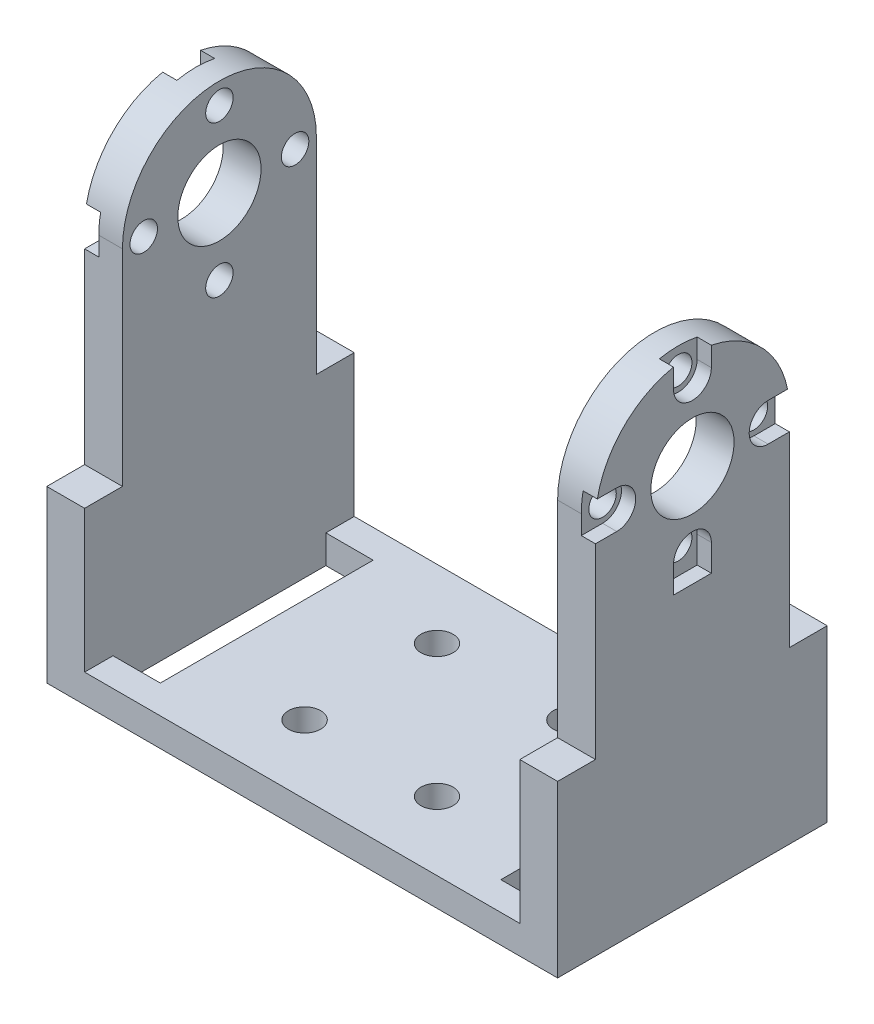
from build123d import *

# Parameters (mm, degrees)
SKETCH1_W           = 54
SKETCH1_H           = 28.5
SKETCH1_W_2         = 5
SKETCH1_H_2         = 22.5
SKETCH1_R           = 1.7
SKETCH1_R_2         = 7.5
BOSS_EXTRUDE2_DEPTH = 3
SKETCH2_W           = 4
SKETCH2_H           = 20.5
BOSS_EXTRUDE3_DEPTH = 21.75
SKETCH4_R           = 10.25
BOSS_EXTRUDE4_DEPTH = 4
SKETCH6_R           = 4.4
SKETCH6_R_2         = 1.45
CUT_EXTRUDE3_DEPTH  = 4
SKETCH7_R           = 1.45
CUT_EXTRUDE4_DEPTH  = 1.5
SKETCH8_W           = 28.781481152
SKETCH8_H           = 28.5
BOSS_EXTRUDE5_DEPTH = 3
SKETCH9_R           = 1.7
CUT_EXTRUDE5_DEPTH  = 3
SKETCH10_W          = 54
SKETCH10_H          = 28.5
SKETCH10_R          = 1.7
SKETCH10_W_2        = 5
SKETCH10_H_2        = 22.5
BOSS_EXTRUDE6_DEPTH = 15
SKETCH11_W          = 46
SKETCH11_H          = 15
CUT_EXTRUDE6_DEPTH  = 53.595151868


with BuildPart() as part:
    # Sketch1 → Boss-Extrude2 (new body)
    with BuildSketch(Plane(origin=(0, 0, 0), x_dir=(1, 0, 0), z_dir=(0, 1, 0))):
        Rectangle(SKETCH1_W, SKETCH1_H)
        with Locations((20.5, 0)):
            Rectangle(SKETCH1_W_2, SKETCH1_H_2, mode=Mode.SUBTRACT)
        with Locations((-20.5, 0)):
            Rectangle(SKETCH1_W_2, SKETCH1_H_2, mode=Mode.SUBTRACT)
        with Locations((-9, -8.25)):
            Circle(SKETCH1_R, mode=Mode.SUBTRACT)
        with Locations((9, -8.25)):
            Circle(SKETCH1_R, mode=Mode.SUBTRACT)
        with Locations((-9, 8.25)):
            Circle(SKETCH1_R, mode=Mode.SUBTRACT)
        Circle(SKETCH1_R_2, mode=Mode.SUBTRACT)
        with Locations((9, 8.25)):
            Circle(SKETCH1_R, mode=Mode.SUBTRACT)
    extrude(amount=BOSS_EXTRUDE2_DEPTH)

    # Sketch2 → Boss-Extrude3 (add)
    with BuildSketch(Plane(origin=(0, 3, 0), x_dir=(1, 0, 0), z_dir=(0, 1, 0))):
        with Locations((25, 0)):
            Rectangle(SKETCH2_W, SKETCH2_H)
    boss_extrude3 = extrude(amount=BOSS_EXTRUDE3_DEPTH)

    # Sketch4 → Boss-Extrude4 (add)
    with BuildSketch(Plane(origin=(27, 0, 0), x_dir=(0, 0, -1), z_dir=(1, 0, 0))):
        with Locations((0, 24.75)):
            Circle(SKETCH4_R)
    boss_extrude4 = extrude(amount=-BOSS_EXTRUDE4_DEPTH)

    # Mirror1: Boss-Extrude3, Boss-Extrude4 across plane
    add(boss_extrude3.mirror(Plane(origin=(0, 0, 0), x_dir=(0, 0, 1), z_dir=(1, 0, 0))))
    add(boss_extrude4.mirror(Plane(origin=(0, 0, 0), x_dir=(0, 0, 1), z_dir=(1, 0, 0))))

    # Sketch6 → Cut-Extrude3 (cut)
    with BuildSketch(Plane(origin=(27, 0, 0), x_dir=(0, 0, -1), z_dir=(1, 0, 0))):
        with Locations((0, 24.75)):
            Circle(SKETCH6_R)
        with Locations((8, 24.75)):
            Circle(SKETCH6_R_2)
        with Locations((0, 32.75)):
            Circle(SKETCH6_R_2)
        with Locations((0, 16.75)):
            Circle(SKETCH6_R_2)
        with Locations((-8, 24.75)):
            Circle(SKETCH6_R_2)
    cut_extrude3 = extrude(amount=-CUT_EXTRUDE3_DEPTH, mode=Mode.SUBTRACT)

    # Mirror3: Cut-Extrude3 across plane
    add(cut_extrude3.mirror(Plane(origin=(0, 0, 0), x_dir=(0, 0, 1), z_dir=(1, 0, 0))), mode=Mode.SUBTRACT)

    # Sketch7 → Cut-Extrude4 (cut)
    # profile 1 of 4: a face of its own
    with BuildSketch(Plane(origin=(27, 0, 0), x_dir=(0, 0, -1), z_dir=(1, 0, 0))):
        with BuildLine():
            ThreePointArc((10.25, 24.75), (10.200627247, 25.754840168), (10.052984631, 26.75))
            Line((10.052984631, 26.75), (8, 26.75))
            ThreePointArc((8, 26.75), (6, 24.75), (8, 22.75))
            Line((8, 22.75), (10.25, 22.75))
            Line((10.25, 22.75), (10.25, 24.75))
        make_face()
        with Locations((8, 24.75)):
            Circle(SKETCH7_R, mode=Mode.SUBTRACT)
    # profile 2 of 4: a face of its own
    with BuildSketch(Plane(origin=(27, 0, 0), x_dir=(0, 0, -1), z_dir=(1, 0, 0))):
        with BuildLine():
            Line((-2, 35.572359929), (-2, 32.75))
            ThreePointArc((-2, 32.75), (0, 30.75), (2, 32.75))
            Line((2, 32.75), (2, 35.572359929))
            Line((2, 35.572359929), (-2, 35.572359929))
        make_face()
        with Locations((0, 32.75)):
            Circle(SKETCH7_R, mode=Mode.SUBTRACT)
    # profile 3 of 4: a face of its own
    with BuildSketch(Plane(origin=(27, 0, 0), x_dir=(0, 0, -1), z_dir=(1, 0, 0))):
        with BuildLine():
            Line((-8, 26.75), (-10.052984631, 26.75))
            ThreePointArc((-10.052984631, 26.75), (-10.200627247, 25.754840168), (-10.25, 24.75))
            Line((-10.25, 24.75), (-10.25, 22.75))
            Line((-10.25, 22.75), (-8, 22.75))
            ThreePointArc((-8, 22.75), (-6, 24.75), (-8, 26.75))
        make_face()
        with Locations((-8, 24.75)):
            Circle(SKETCH7_R, mode=Mode.SUBTRACT)
    # profile 4 of 4: a face of its own
    with BuildSketch(Plane(origin=(27, 0, 0), x_dir=(0, 0, -1), z_dir=(1, 0, 0))):
        with BuildLine():
            ThreePointArc((2, 16.75), (0, 18.75), (-2, 16.75))
            Line((-2, 16.75), (-2, 13.927640071))
            Line((-2, 13.927640071), (2, 13.927640071))
            Line((2, 13.927640071), (2, 16.75))
        make_face()
        with Locations((0, 16.75)):
            Circle(SKETCH7_R, mode=Mode.SUBTRACT)
    cut_extrude4 = extrude(amount=-CUT_EXTRUDE4_DEPTH, mode=Mode.SUBTRACT)

    # Mirror4: Cut-Extrude4 across plane
    add(cut_extrude4.mirror(Plane(origin=(0, 0, 0), x_dir=(0, 0, 1), z_dir=(1, 0, 0))), mode=Mode.SUBTRACT)

    # Sketch8 → Boss-Extrude5 (add)
    with BuildSketch(Plane(origin=(0, 3, 0), x_dir=(1, 0, 0), z_dir=(0, 1, 0))):
        Rectangle(SKETCH8_W, SKETCH8_H)
    extrude(amount=-BOSS_EXTRUDE5_DEPTH)

    # Sketch9 → Cut-Extrude5 (cut)
    with BuildSketch(Plane(origin=(0, 3, 0), x_dir=(1, 0, 0), z_dir=(0, 1, 0))):
        with Locations((-7, 7)):
            Circle(SKETCH9_R)
        with Locations((7, 7)):
            Circle(SKETCH9_R)
        with Locations((-7, -7)):
            Circle(SKETCH9_R)
        with Locations((7, -7)):
            Circle(SKETCH9_R)
    extrude(amount=-CUT_EXTRUDE5_DEPTH, mode=Mode.SUBTRACT)

    # Sketch10 → Boss-Extrude6 (add)
    with BuildSketch(Plane.XZ):
        Rectangle(SKETCH10_W, SKETCH10_H)
        with Locations((-7, 7)):
            Circle(SKETCH10_R, mode=Mode.SUBTRACT)
        with Locations((-7, -7)):
            Circle(SKETCH10_R, mode=Mode.SUBTRACT)
        with Locations((7, -7)):
            Circle(SKETCH10_R, mode=Mode.SUBTRACT)
        with Locations((7, 7)):
            Circle(SKETCH10_R, mode=Mode.SUBTRACT)
        with Locations((-20.5, 0)):
            Rectangle(SKETCH10_W_2, SKETCH10_H_2, mode=Mode.SUBTRACT)
        with Locations((20.5, 0)):
            Rectangle(SKETCH10_W_2, SKETCH10_H_2, mode=Mode.SUBTRACT)
    extrude(amount=BOSS_EXTRUDE6_DEPTH)

    # Sketch11 → Cut-Extrude6 (cut, through all)
    with BuildSketch(Plane.XY.offset(14.25)):
        with Locations((0, -4.5)):
            Rectangle(SKETCH11_W, SKETCH11_H)
    extrude(amount=-CUT_EXTRUDE6_DEPTH, mode=Mode.SUBTRACT)


solid = part.part
